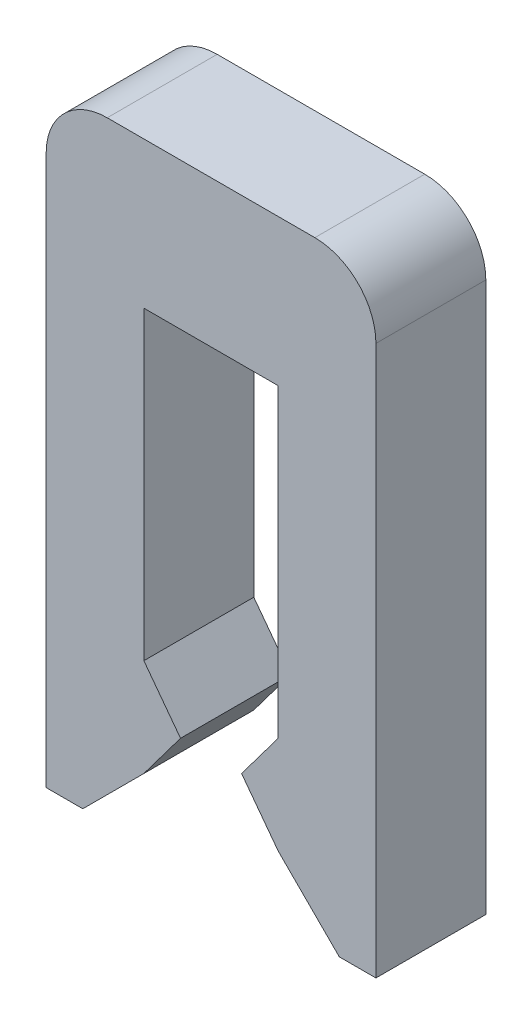
from build123d import *

# Parameters (mm, degrees)
EXTRUDE_1_DEPTH = 0.9
CHAMFER_1_SIZE  = 0.5
FILLET_1_R      = 0.5
EXTRUDE_2_DEPTH = 0.9


with BuildPart() as part:
    # Эскиз1 → Бобышка-Вытянуть1 (new body)
    with BuildSketch(Plane.XY):
        Polygon((-0.55, 0), (0.55, 0), (0.55, -3.8), (1.35, -3.8), (1.35, 1.2), (-1.35, 1.2), (-1.35, -3.8), (-0.55, -3.8), align=None)
    extrude(amount=EXTRUDE_1_DEPTH)

    # Фаска1
    chamfer_1_edges = [part.edges().sort_by_distance(p)[0] for p in [
        (-0.55, -3.8, 0.45),
        (0.55, -3.8, 0.45),
    ]]
    chamfer(chamfer_1_edges, length=CHAMFER_1_SIZE)

    # Скругление1
    fillet_1_edges = [part.edges().sort_by_distance(p)[0] for p in [
        (1.35, 1.2, 0.45),
        (-1.35, 1.2, 0.45),
    ]]
    fillet(fillet_1_edges, radius=FILLET_1_R)

    # Эскиз2 → Бобышка-Вытянуть2 (add)
    with BuildSketch(Plane.XY.offset(0.9)):
        Polygon((-0.55, -3.3), (-0.55, -2.5), (-0.25, -2.9), align=None)
    extrude_2 = extrude(amount=-EXTRUDE_2_DEPTH)

    # Зеркальное отражение1: Бобышка-Вытянуть2 across plane
    add(extrude_2.mirror(Plane(origin=(0, 0, 0), x_dir=(0, 0, 1), z_dir=(1, 0, 0))))


solid = part.part
